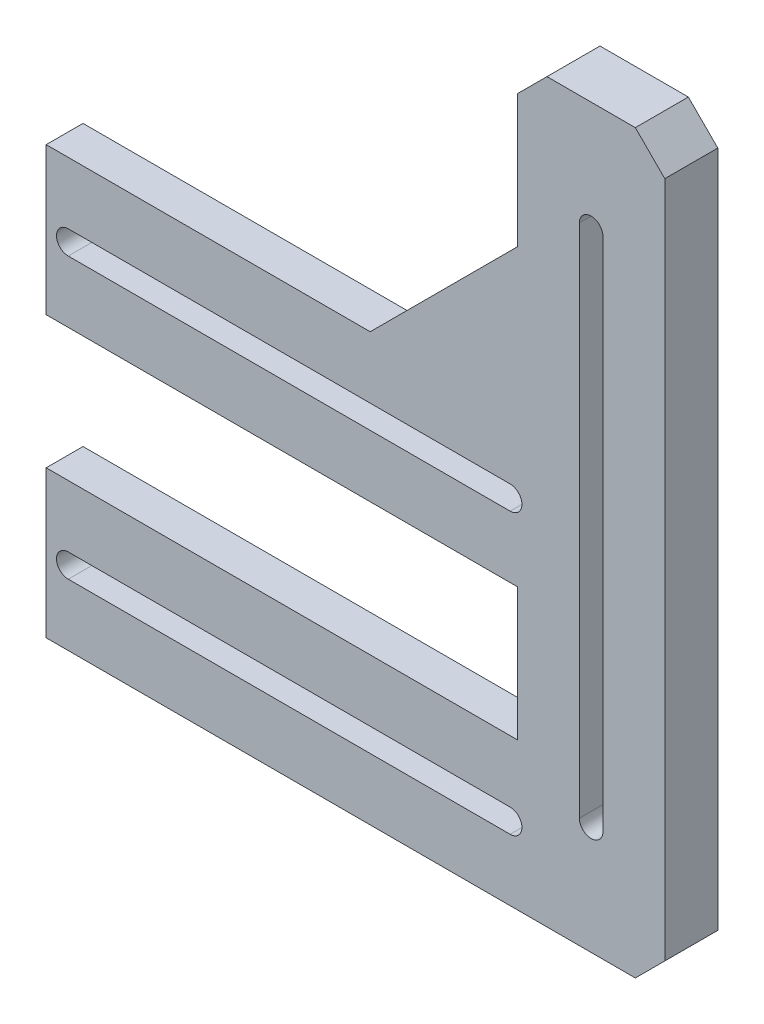
from build123d import *

# Parameters (mm, degrees)
SKETCH_1_W                  = 20
SKETCH_1_H                  = 20
SKETCH_1_W_2                = 64
SKETCH_1_H_2                = 18
SKETCH_1_H_3                = 42
EXTRUDE_1_DEPTH             = 5
SKETCH_2_W                  = 20
SKETCH_2_H                  = 100
EXTRUDE_2_DEPTH             = 2.2
HOLE_START                  = -2.2
HOLE_WIZARD_3_2_3_2_1_DEPTH = 7.2
HOLE_WIZARD_3_2_3_2_2_DEPTH = 7.2
RIB_1_REACH                 = 88.214
SKETCH_11_WALL_W            = 202.712111226
SKETCH_11_WALL_H            = 5
CHAMFER_1_SIZE              = 4


# Read off the part's stored shape, not the designer's step: Ø3.2 (3.2) 直径槽口1, Ø3.2 (3.2) 直径槽口2
with BuildPart() as part:
    # 草图1 → 凸台-拉伸1 (new body)
    with BuildSketch(Plane.XY):
        with Locations((45, -24)):
            Rectangle(SKETCH_1_W, SKETCH_1_H)
        with Locations((3, -24)):
            Rectangle(SKETCH_1_W_2, SKETCH_1_H)
        with Locations((3, 14)):
            Rectangle(SKETCH_1_W_2, SKETCH_1_H)
        with Locations((45, -5)):
            Rectangle(SKETCH_1_W, SKETCH_1_H_2)
        with Locations((45, 45)):
            Rectangle(SKETCH_1_W, SKETCH_1_H_3)
        with Locations((45, 14)):
            Rectangle(SKETCH_1_W, SKETCH_1_H)
    extrude(amount=EXTRUDE_1_DEPTH)

    # 草图2 → 凸台-拉伸2 (add)
    with BuildSketch(Plane(origin=(0, 0, 0), x_dir=(-1, 0, 0), z_dir=(0, 0, -1))):
        with Locations((-45, 16)):
            Rectangle(SKETCH_2_W, SKETCH_2_H)
    extrude(amount=EXTRUDE_2_DEPTH)

    # Ø3.2 (3.2) 直径槽口1 outline → Ø3.2 (3.2) 直径槽口1 (cut)
    with BuildSketch(Plane.XY.offset(HOLE_START)):
        with BuildLine():
            Line((34, -22.4), (-26, -22.4))
            ThreePointArc((-26, -22.4), (-27.6, -24), (-26, -25.6))
            Line((-26, -25.6), (34, -25.6))
            ThreePointArc((34, -25.6), (35.6, -24), (34, -22.4))
        make_face()
        with BuildLine():
            ThreePointArc((34, 12.4), (35.6, 14), (34, 15.6))
            Line((34, 15.6), (-26, 15.6))
            ThreePointArc((-26, 15.6), (-27.6, 14), (-26, 12.4))
            Line((-26, 12.4), (34, 12.4))
        make_face()
    extrude(amount=HOLE_WIZARD_3_2_3_2_1_DEPTH, mode=Mode.SUBTRACT)

    # Ø3.2 (3.2) 直径槽口2 outline → Ø3.2 (3.2) 直径槽口2 (cut)
    with BuildSketch(Plane.XY.offset(HOLE_START)):
        with BuildLine():
            Line((46.6, -19), (46.6, 51))
            ThreePointArc((46.6, 51), (45, 52.6), (43.4, 51))
            Line((43.4, 51), (43.4, -19))
            ThreePointArc((43.4, -19), (45, -20.6), (46.6, -19))
        make_face()
    extrude(amount=HOLE_WIZARD_3_2_3_2_2_DEPTH, mode=Mode.SUBTRACT)

    # 草图11 wall → 筋1 (add, up to next)
    with BuildSketch(Plane(origin=(25, 34, 5), x_dir=(0.707106781187, 0.707106781187, 0), z_dir=(-0.707106781187, 0.707106781187, 0)), mode=Mode.PRIVATE) as rib_1_sk1:
        with Locations((0, 2.5)):
            Rectangle(SKETCH_11_WALL_W, SKETCH_11_WALL_H)
    rib_1_tool1 = extrude(rib_1_sk1.sketch, amount=-RIB_1_REACH, mode=Mode.PRIVATE) - part.part
    add(rib_1_tool1.solids().sort_by_distance((25, 34, 5))[0])

    # 倒角1
    chamfer_1_edges = [part.edges().sort_by_distance(p)[0] for p in [
        (35, 66, 1.4),
        (55, 66, 1.4),
        (55, -34, 1.4),
    ]]
    chamfer(chamfer_1_edges, length=CHAMFER_1_SIZE)


solid = part.part
